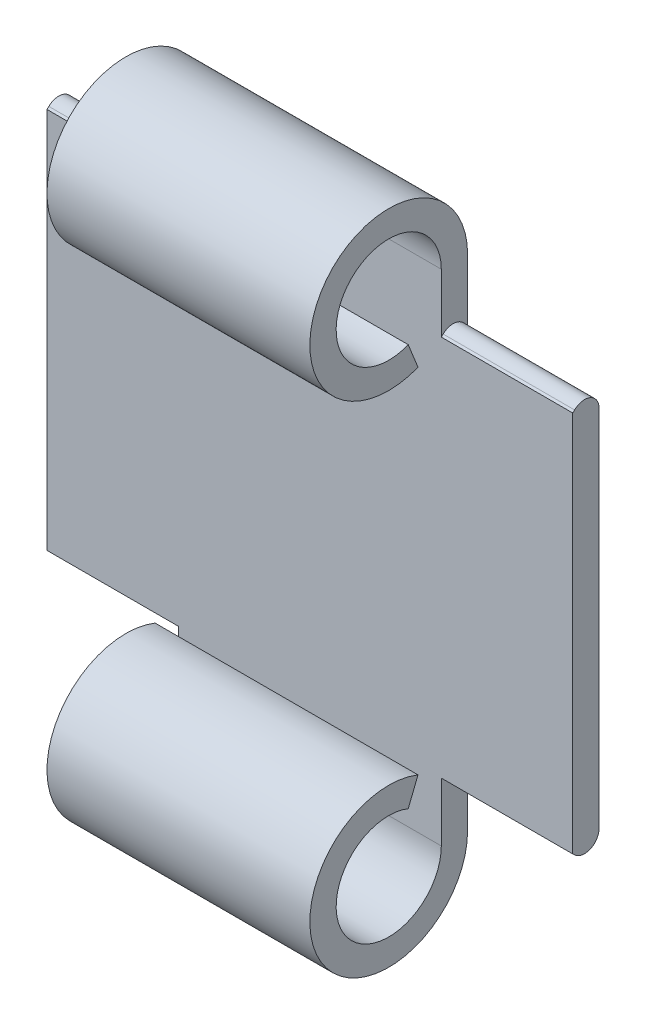
from build123d import *

# Parameters (mm, degrees)
SKETCH1_W               = 40
SKETCH1_H               = 50
BOSS_EXTRUDE1_DEPTH     = 2
SKETCH3_W               = 40
SKETCH3_H               = 6
CUT_EXTRUDE3_DEPTH      = 3
SKETCH8_W               = 40
SKETCH8_H               = 6
CUT_EXTRUDE4_DEPTH      = 10
BOSS_EXTRUDE2_DEPTH     = 10
CUT_EXTRUDE5_START      = 10
SKETCH9_R               = 6
CUT_EXTRUDE5_DEPTH      = 10
MIRROR4_START           = 10
MIRROR4_COPY_1_SKETCH_R = 6
MIRROR4_COPY_1_DEPTH    = 10
FILLET1_R               = 1.1


with BuildPart() as part:
    # Sketch1 → Boss-Extrude1 (new body)
    with BuildSketch(Plane.XY):
        with Locations((20, 25)):
            Rectangle(SKETCH1_W, SKETCH1_H)
    extrude(amount=BOSS_EXTRUDE1_DEPTH)

    # Sketch3 → Cut-Extrude3 (cut)
    with BuildSketch(Plane.XY.offset(2)):
        with Locations((20, 3)):
            Rectangle(SKETCH3_W, SKETCH3_H)
    extrude(amount=-CUT_EXTRUDE3_DEPTH, mode=Mode.SUBTRACT)

    # Sketch8 → Cut-Extrude4 (cut)
    with BuildSketch(Plane.XY.offset(2)):
        with Locations((20, 47)):
            Rectangle(SKETCH8_W, SKETCH8_H)
    extrude(amount=-CUT_EXTRUDE4_DEPTH, mode=Mode.SUBTRACT)

    # Sketch6 → Boss-Extrude2 (add, symmetric)
    with BuildSketch(Plane(origin=(20, 0, -40), x_dir=(0, 0, 1), z_dir=(-1, 0, 0))):
        with BuildLine():
            Line((43.77260129, 11.571238192), (44.515067527, 9.714158794))
            ThreePointArc((44.515067527, 9.714158794), (48.242796258, 9.312078644), (50, 6))
            ThreePointArc((50, 6), (46, 2), (42, 6))
            Line((42, 6), (40, 6))
            ThreePointArc((40, 6), (46, 0), (52, 6))
            ThreePointArc((52, 6), (49.364194387, 10.968117966), (43.77260129, 11.571238192))
        make_face()
    boss_extrude2 = extrude(amount=BOSS_EXTRUDE2_DEPTH, both=True)

    # Mirror2: Boss-Extrude2 across plane
    add(boss_extrude2.mirror(Plane(origin=(0, 25, 0), x_dir=(0, 0, 1), z_dir=(0, -1, 0))))

    # Sketch9 → Cut-Extrude5 (cut)
    with BuildSketch(Plane.ZY.offset(-10).offset(CUT_EXTRUDE5_START)):
        with Locations((6, 6)):
            Circle(SKETCH9_R)
    cut_extrude5 = extrude(amount=-CUT_EXTRUDE5_DEPTH, mode=Mode.SUBTRACT)

    # Mirror3: Cut-Extrude5 across plane
    add(cut_extrude5.mirror(Plane(origin=(20, 0, 0), x_dir=(0, 0, 1), z_dir=(1, 0, 0))), mode=Mode.SUBTRACT)

    # Mirror4: Cut-Extrude5 across plane
    add(cut_extrude5.mirror(Plane(origin=(0, 25, 0), x_dir=(0, 0, 1), z_dir=(0, -1, 0))), mode=Mode.SUBTRACT)

    # Mirror4 copy 1 sketch → Mirror4 copy 1 (cut)
    with BuildSketch(Plane(origin=(30, 50, 0), x_dir=(0, 0, 1), z_dir=(1, 0, 0)).offset(MIRROR4_START)):
        with Locations((6, 6)):
            Circle(MIRROR4_COPY_1_SKETCH_R)
    extrude(amount=-MIRROR4_COPY_1_DEPTH, mode=Mode.SUBTRACT)

    # Fillet1
    # the kernel refuses this fillet: 1.1 mm, written as the material it takes off along each edge
    with BuildSketch(Plane(origin=(70.828558189, 6, 0), x_dir=(0, 0.9192771195538384, 0.393610946830494), z_dir=(-1, 0, 0)), Plane(origin=(10, 6, 0), x_dir=(0, 0.9192771195538384, 0.3936109468304938), z_dir=(-1, 0, 0))) as fillet1_piece_1:
        with BuildLine():
            CenterArc((5.156303403, 1.011204832), FILLET1_R, 113.179370495, 133.641259009)
            Line((4.723331362, 2.022409663), (4.714671921, 2.04263376))
            Line((4.714671921, 2.04263376), (-0.008659441, 0.020224097))
            Line((-0.008659441, 0.020224097), (0.008659441, -0.020224097))
            ThreePointArc((0.008659441, -0.020224097), (2.361665681, 0.462337283), (4.714671921, -0.020224097))
            Line((4.714671921, -0.020224097), (4.723331362, 0))
        make_face()
    extrude(amount=40.828558189, mode=Mode.SUBTRACT)
    with BuildSketch(Plane(origin=(70.828558189, 6, 0), x_dir=(0, 0.9192771195538384, 0.393610946830494), z_dir=(-1, 0, 0))) as fillet1_piece_2_section:
        with BuildLine():
            CenterArc((5.156303403, 1.011204832), FILLET1_R, 113.179370495, 133.641259009)
            Line((4.723331362, 2.022409663), (4.714671921, 2.04263376))
            Line((4.714671921, 2.04263376), (-0.008659441, 0.020224097))
            Line((-0.008659441, 0.020224097), (0.008659441, -0.020224097))
            ThreePointArc((0.008659441, -0.020224097), (2.361665681, 0.462337283), (4.714671921, -0.020224097))
            Line((4.714671921, -0.020224097), (4.723331362, 0))
        make_face()
    fillet1_piece_2 = extrude(amount=71.657116378, mode=Mode.PRIVATE)
    fillet1_piece_2 = split(fillet1_piece_2, bisect_by=Plane(origin=(10, 9.140941458, 0.431936904), z_dir=(-1, 0, 0)), keep=Keep.TOP, mode=Mode.PRIVATE)
    add(fillet1_piece_2, mode=Mode.SUBTRACT)
    with BuildSketch(Plane(origin=(70.828558189, 44, 0), x_dir=(0, -0.9192771195538351, 0.39361094683050163), z_dir=(-1, 0, 0)), Plane(origin=(10, 44, 0), x_dir=(0, -0.9192771195538407, 0.39361094683048864), z_dir=(-1, 0, 0))) as fillet1_piece_3:
        with BuildLine():
            CenterArc((5.156303403, -1.011204832), FILLET1_R, 113.179370495, 133.641259009)
            Line((4.723331362, -2.022409663), (4.714671921, -2.04263376))
            Line((4.714671921, -2.04263376), (-0.008659441, -0.020224097))
            Line((-0.008659441, -0.020224097), (0.008659441, 0.020224097))
            ThreePointArc((0.008659441, 0.020224097), (2.361665681, -0.462337283), (4.714671921, 0.020224097))
            Line((4.714671921, 0.020224097), (4.723331362, 0))
        make_face()
    extrude(amount=40.828558189, mode=Mode.SUBTRACT)
    with BuildSketch(Plane(origin=(70.828558189, 44, 0), x_dir=(0, -0.9192771195538351, 0.39361094683050163), z_dir=(-1, 0, 0))) as fillet1_piece_4_section:
        with BuildLine():
            CenterArc((5.156303403, -1.011204832), FILLET1_R, 113.179370495, 133.641259009)
            Line((4.723331362, -2.022409663), (4.714671921, -2.04263376))
            Line((4.714671921, -2.04263376), (-0.008659441, -0.020224097))
            Line((-0.008659441, -0.020224097), (0.008659441, 0.020224097))
            ThreePointArc((0.008659441, 0.020224097), (2.361665681, -0.462337283), (4.714671921, 0.020224097))
            Line((4.714671921, 0.020224097), (4.723331362, 0))
        make_face()
    fillet1_piece_4 = extrude(amount=71.657116378, mode=Mode.PRIVATE)
    fillet1_piece_4 = split(fillet1_piece_4, bisect_by=Plane(origin=(10, 40.859058542, 0.431936904), z_dir=(-1, 0, 0)), keep=Keep.TOP, mode=Mode.PRIVATE)
    add(fillet1_piece_4, mode=Mode.SUBTRACT)
    with BuildSketch(Plane(origin=(40.828558189, 6, 0), x_dir=(0, 0.9192771195538384, 0.393610946830494), z_dir=(-1, 0, 0))) as fillet1_piece_5_section:
        with BuildLine():
            CenterArc((5.156303403, 1.011204832), FILLET1_R, 113.179370495, 133.641259009)
            Line((4.723331362, 2.022409663), (4.714671921, 2.04263376))
            Line((4.714671921, 2.04263376), (-0.008659441, 0.020224097))
            Line((-0.008659441, 0.020224097), (0.008659441, -0.020224097))
            ThreePointArc((0.008659441, -0.020224097), (2.361665681, 0.462337283), (4.714671921, -0.020224097))
            Line((4.714671921, -0.020224097), (4.723331362, 0))
        make_face()
    fillet1_piece_5 = extrude(amount=71.657116378, mode=Mode.PRIVATE)
    fillet1_piece_5 = split(fillet1_piece_5, bisect_by=Plane(origin=(30, 9.140941458, 0.431936904), z_dir=(1, 0, 0)), keep=Keep.TOP, mode=Mode.PRIVATE)
    add(fillet1_piece_5, mode=Mode.SUBTRACT)
    with BuildSketch(Plane(origin=(40.828558189, 44, 0), x_dir=(0, -0.9192771195538353, 0.3936109468305011), z_dir=(-1, 0, 0))) as fillet1_piece_6_section:
        with BuildLine():
            CenterArc((5.156303403, -1.011204832), FILLET1_R, 113.179370495, 133.641259009)
            Line((4.723331362, -2.022409663), (4.714671921, -2.04263376))
            Line((4.714671921, -2.04263376), (-0.008659441, -0.020224097))
            Line((-0.008659441, -0.020224097), (0.008659441, 0.020224097))
            ThreePointArc((0.008659441, 0.020224097), (2.361665681, -0.462337283), (4.714671921, 0.020224097))
            Line((4.714671921, 0.020224097), (4.723331362, 0))
        make_face()
    fillet1_piece_6 = extrude(amount=71.657116378, mode=Mode.PRIVATE)
    fillet1_piece_6 = split(fillet1_piece_6, bisect_by=Plane(origin=(30, 40.859058542, 0.431936904), z_dir=(1, 0, 0)), keep=Keep.TOP, mode=Mode.PRIVATE)
    add(fillet1_piece_6, mode=Mode.SUBTRACT)


solid = part.part
